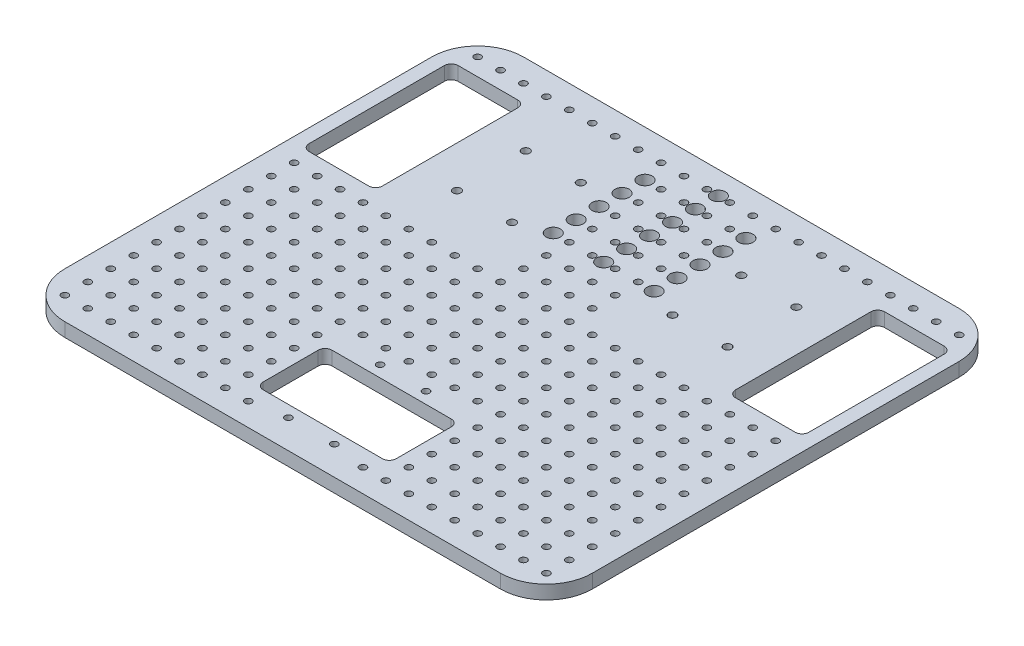
from build123d import *

# Parameters (mm, degrees)
SKETCH_1_W          = 230
SKETCH_1_H          = 200
SKETCH_1_R          = 1.73
EXTRUDE_1_DEPTH     = 6
FILLET_1_R          = 20
SKETCH_2_R          = 1.5
SKETCH_2_W          = 32
SKETCH_2_H          = 65
SKETCH_2_W_2        = 58
SKETCH_2_H_2        = 30
CUT_EXTRUDE_1_DEPTH = 10
FILLET_2_R          = 3
SKETCH_3_R          = 1.5
SKETCH_3_R_2        = 3.1
CUT_EXTRUDE_2_DEPTH = 10


with BuildPart() as part:
    # Эскиз1 → Бобышка-Вытянуть1 (new body)
    with BuildSketch(Plane(origin=(0, 0, 0), x_dir=(1, 0, 0), z_dir=(0, 1, 0))):
        with Locations((115, 100)):
            Rectangle(SKETCH_1_W, SKETCH_1_H)
        with Locations((80, 135)):
            Circle(SKETCH_1_R, mode=Mode.SUBTRACT)
        with Locations((80, 165)):
            Circle(SKETCH_1_R, mode=Mode.SUBTRACT)
        with Locations((56, 165)):
            Circle(SKETCH_1_R, mode=Mode.SUBTRACT)
        with Locations((56, 135)):
            Circle(SKETCH_1_R, mode=Mode.SUBTRACT)
        with Locations((150, 135)):
            Circle(SKETCH_1_R, mode=Mode.SUBTRACT)
        with Locations((174, 135)):
            Circle(SKETCH_1_R, mode=Mode.SUBTRACT)
        with Locations((150, 165)):
            Circle(SKETCH_1_R, mode=Mode.SUBTRACT)
        with Locations((174, 165)):
            Circle(SKETCH_1_R, mode=Mode.SUBTRACT)
    extrude(amount=EXTRUDE_1_DEPTH)

    # Скругление1
    fillet_1_edges = [part.edges().sort_by_distance(p)[0] for p in [
        (0, 3, 0),
        (230, 3, 0),
        (230, 3, -200),
        (0, 3, -200),
    ]]
    fillet(fillet_1_edges, radius=FILLET_1_R)

    # Эскиз2 → Вырез-Вытянуть1 (cut)
    with BuildSketch(Plane(origin=(0, 6, 0), x_dir=(1, 0, 0), z_dir=(0, 1, 0))):
        with Locations((105, 12.5)):
            Circle(SKETCH_2_R)
        with Locations((125, 12.5)):
            Circle(SKETCH_2_R)
        with Locations((105, 52.5)):
            Circle(SKETCH_2_R)
        with Locations((125, 52.5)):
            Circle(SKETCH_2_R)
        with Locations((208, 150)):
            Rectangle(SKETCH_2_W, SKETCH_2_H)
        with Locations((22, 150)):
            Rectangle(SKETCH_2_W, SKETCH_2_H)
        with Locations((115, 32.5)):
            Rectangle(SKETCH_2_W_2, SKETCH_2_H_2)
    extrude(amount=-CUT_EXTRUDE_1_DEPTH, mode=Mode.SUBTRACT)

    # Скругление2
    fillet_2_edges = [part.edges().sort_by_distance(p)[0] for p in [
        (224, 3, -117.5),
        (224, 3, -182.5),
        (192, 3, -182.5),
        (192, 3, -117.5),
        (6, 3, -117.5),
        (38, 3, -117.5),
        (38, 3, -182.5),
        (6, 3, -182.5),
        (86, 3, -17.5),
        (144, 3, -17.5),
        (144, 3, -47.5),
        (86, 3, -47.5),
    ]]
    fillet(fillet_2_edges, radius=FILLET_2_R)

    # Эскиз3 → Вырез-Вытянуть2 (cut)
    with BuildSketch(Plane(origin=(0, 6, 0), x_dir=(1, 0, 0), z_dir=(0, 1, 0))):
        with Locations((10, 10)):
            Circle(SKETCH_3_R)
        with Locations((20, 10)):
            Circle(SKETCH_3_R)
        with Locations((30, 10)):
            Circle(SKETCH_3_R)
        with Locations((40, 10)):
            Circle(SKETCH_3_R)
        with Locations((50, 10)):
            Circle(SKETCH_3_R)
        with Locations((60, 10)):
            Circle(SKETCH_3_R)
        with Locations((70, 10)):
            Circle(SKETCH_3_R)
        with Locations((80, 10)):
            Circle(SKETCH_3_R)
        with Locations((90, 10)):
            Circle(SKETCH_3_R)
        with Locations((140, 10)):
            Circle(SKETCH_3_R)
        with Locations((150, 10)):
            Circle(SKETCH_3_R)
        with Locations((160, 10)):
            Circle(SKETCH_3_R)
        with Locations((170, 10)):
            Circle(SKETCH_3_R)
        with Locations((180, 10)):
            Circle(SKETCH_3_R)
        with Locations((190, 10)):
            Circle(SKETCH_3_R)
        with Locations((200, 10)):
            Circle(SKETCH_3_R)
        with Locations((210, 10)):
            Circle(SKETCH_3_R)
        with Locations((220, 10)):
            Circle(SKETCH_3_R)
        with Locations((20, 20)):
            Circle(SKETCH_3_R)
        with Locations((30, 20)):
            Circle(SKETCH_3_R)
        with Locations((40, 20)):
            Circle(SKETCH_3_R)
        with Locations((50, 20)):
            Circle(SKETCH_3_R)
        with Locations((60, 20)):
            Circle(SKETCH_3_R)
        with Locations((70, 20)):
            Circle(SKETCH_3_R)
        with Locations((80, 20)):
            Circle(SKETCH_3_R)
        with Locations((150, 20)):
            Circle(SKETCH_3_R)
        with Locations((160, 20)):
            Circle(SKETCH_3_R)
        with Locations((170, 20)):
            Circle(SKETCH_3_R)
        with Locations((180, 20)):
            Circle(SKETCH_3_R)
        with Locations((190, 20)):
            Circle(SKETCH_3_R)
        with Locations((200, 20)):
            Circle(SKETCH_3_R)
        with Locations((210, 20)):
            Circle(SKETCH_3_R)
        with Locations((220, 20)):
            Circle(SKETCH_3_R)
        with Locations((20, 30)):
            Circle(SKETCH_3_R)
        with Locations((30, 30)):
            Circle(SKETCH_3_R)
        with Locations((40, 30)):
            Circle(SKETCH_3_R)
        with Locations((50, 30)):
            Circle(SKETCH_3_R)
        with Locations((60, 30)):
            Circle(SKETCH_3_R)
        with Locations((70, 30)):
            Circle(SKETCH_3_R)
        with Locations((80, 30)):
            Circle(SKETCH_3_R)
        with Locations((150, 30)):
            Circle(SKETCH_3_R)
        with Locations((160, 30)):
            Circle(SKETCH_3_R)
        with Locations((170, 30)):
            Circle(SKETCH_3_R)
        with Locations((180, 30)):
            Circle(SKETCH_3_R)
        with Locations((190, 30)):
            Circle(SKETCH_3_R)
        with Locations((200, 30)):
            Circle(SKETCH_3_R)
        with Locations((210, 30)):
            Circle(SKETCH_3_R)
        with Locations((220, 30)):
            Circle(SKETCH_3_R)
        with Locations((20, 40)):
            Circle(SKETCH_3_R)
        with Locations((30, 40)):
            Circle(SKETCH_3_R)
        with Locations((40, 40)):
            Circle(SKETCH_3_R)
        with Locations((50, 40)):
            Circle(SKETCH_3_R)
        with Locations((60, 40)):
            Circle(SKETCH_3_R)
        with Locations((70, 40)):
            Circle(SKETCH_3_R)
        with Locations((80, 40)):
            Circle(SKETCH_3_R)
        with Locations((150, 40)):
            Circle(SKETCH_3_R)
        with Locations((160, 40)):
            Circle(SKETCH_3_R)
        with Locations((170, 40)):
            Circle(SKETCH_3_R)
        with Locations((180, 40)):
            Circle(SKETCH_3_R)
        with Locations((190, 40)):
            Circle(SKETCH_3_R)
        with Locations((200, 40)):
            Circle(SKETCH_3_R)
        with Locations((210, 40)):
            Circle(SKETCH_3_R)
        with Locations((220, 40)):
            Circle(SKETCH_3_R)
        with Locations((20, 50)):
            Circle(SKETCH_3_R)
        with Locations((30, 50)):
            Circle(SKETCH_3_R)
        with Locations((40, 50)):
            Circle(SKETCH_3_R)
        with Locations((50, 50)):
            Circle(SKETCH_3_R)
        with Locations((60, 50)):
            Circle(SKETCH_3_R)
        with Locations((70, 50)):
            Circle(SKETCH_3_R)
        with Locations((80, 50)):
            Circle(SKETCH_3_R)
        with Locations((150, 50)):
            Circle(SKETCH_3_R)
        with Locations((160, 50)):
            Circle(SKETCH_3_R)
        with Locations((170, 50)):
            Circle(SKETCH_3_R)
        with Locations((180, 50)):
            Circle(SKETCH_3_R)
        with Locations((190, 50)):
            Circle(SKETCH_3_R)
        with Locations((200, 50)):
            Circle(SKETCH_3_R)
        with Locations((210, 50)):
            Circle(SKETCH_3_R)
        with Locations((220, 50)):
            Circle(SKETCH_3_R)
        with Locations((20, 60)):
            Circle(SKETCH_3_R)
        with Locations((30, 60)):
            Circle(SKETCH_3_R)
        with Locations((40, 60)):
            Circle(SKETCH_3_R)
        with Locations((50, 60)):
            Circle(SKETCH_3_R)
        with Locations((60, 60)):
            Circle(SKETCH_3_R)
        with Locations((70, 60)):
            Circle(SKETCH_3_R)
        with Locations((80, 60)):
            Circle(SKETCH_3_R)
        with Locations((90, 60)):
            Circle(SKETCH_3_R)
        with Locations((100, 60)):
            Circle(SKETCH_3_R)
        with Locations((110, 60)):
            Circle(SKETCH_3_R)
        with Locations((120, 60)):
            Circle(SKETCH_3_R)
        with Locations((130, 60)):
            Circle(SKETCH_3_R)
        with Locations((140, 60)):
            Circle(SKETCH_3_R)
        with Locations((150, 60)):
            Circle(SKETCH_3_R)
        with Locations((160, 60)):
            Circle(SKETCH_3_R)
        with Locations((170, 60)):
            Circle(SKETCH_3_R)
        with Locations((180, 60)):
            Circle(SKETCH_3_R)
        with Locations((190, 60)):
            Circle(SKETCH_3_R)
        with Locations((200, 60)):
            Circle(SKETCH_3_R)
        with Locations((210, 60)):
            Circle(SKETCH_3_R)
        with Locations((220, 60)):
            Circle(SKETCH_3_R)
        with Locations((20, 70)):
            Circle(SKETCH_3_R)
        with Locations((30, 70)):
            Circle(SKETCH_3_R)
        with Locations((40, 70)):
            Circle(SKETCH_3_R)
        with Locations((50, 70)):
            Circle(SKETCH_3_R)
        with Locations((60, 70)):
            Circle(SKETCH_3_R)
        with Locations((70, 70)):
            Circle(SKETCH_3_R)
        with Locations((80, 70)):
            Circle(SKETCH_3_R)
        with Locations((90, 70)):
            Circle(SKETCH_3_R)
        with Locations((100, 70)):
            Circle(SKETCH_3_R)
        with Locations((110, 70)):
            Circle(SKETCH_3_R)
        with Locations((120, 70)):
            Circle(SKETCH_3_R)
        with Locations((130, 70)):
            Circle(SKETCH_3_R)
        with Locations((140, 70)):
            Circle(SKETCH_3_R)
        with Locations((150, 70)):
            Circle(SKETCH_3_R)
        with Locations((160, 70)):
            Circle(SKETCH_3_R)
        with Locations((170, 70)):
            Circle(SKETCH_3_R)
        with Locations((180, 70)):
            Circle(SKETCH_3_R)
        with Locations((190, 70)):
            Circle(SKETCH_3_R)
        with Locations((200, 70)):
            Circle(SKETCH_3_R)
        with Locations((210, 70)):
            Circle(SKETCH_3_R)
        with Locations((220, 70)):
            Circle(SKETCH_3_R)
        with Locations((20, 80)):
            Circle(SKETCH_3_R)
        with Locations((30, 80)):
            Circle(SKETCH_3_R)
        with Locations((40, 80)):
            Circle(SKETCH_3_R)
        with Locations((50, 80)):
            Circle(SKETCH_3_R)
        with Locations((60, 80)):
            Circle(SKETCH_3_R)
        with Locations((70, 80)):
            Circle(SKETCH_3_R)
        with Locations((80, 80)):
            Circle(SKETCH_3_R)
        with Locations((90, 80)):
            Circle(SKETCH_3_R)
        with Locations((100, 80)):
            Circle(SKETCH_3_R)
        with Locations((110, 80)):
            Circle(SKETCH_3_R)
        with Locations((120, 80)):
            Circle(SKETCH_3_R)
        with Locations((130, 80)):
            Circle(SKETCH_3_R)
        with Locations((140, 80)):
            Circle(SKETCH_3_R)
        with Locations((150, 80)):
            Circle(SKETCH_3_R)
        with Locations((160, 80)):
            Circle(SKETCH_3_R)
        with Locations((170, 80)):
            Circle(SKETCH_3_R)
        with Locations((180, 80)):
            Circle(SKETCH_3_R)
        with Locations((190, 80)):
            Circle(SKETCH_3_R)
        with Locations((200, 80)):
            Circle(SKETCH_3_R)
        with Locations((210, 80)):
            Circle(SKETCH_3_R)
        with Locations((220, 80)):
            Circle(SKETCH_3_R)
        with Locations((20, 90)):
            Circle(SKETCH_3_R)
        with Locations((30, 90)):
            Circle(SKETCH_3_R)
        with Locations((40, 90)):
            Circle(SKETCH_3_R)
        with Locations((50, 90)):
            Circle(SKETCH_3_R)
        with Locations((60, 90)):
            Circle(SKETCH_3_R)
        with Locations((70, 90)):
            Circle(SKETCH_3_R)
        with Locations((80, 90)):
            Circle(SKETCH_3_R)
        with Locations((90, 90)):
            Circle(SKETCH_3_R)
        with Locations((100, 90)):
            Circle(SKETCH_3_R)
        with Locations((110, 90)):
            Circle(SKETCH_3_R)
        with Locations((120, 90)):
            Circle(SKETCH_3_R)
        with Locations((130, 90)):
            Circle(SKETCH_3_R)
        with Locations((140, 90)):
            Circle(SKETCH_3_R)
        with Locations((150, 90)):
            Circle(SKETCH_3_R)
        with Locations((160, 90)):
            Circle(SKETCH_3_R)
        with Locations((170, 90)):
            Circle(SKETCH_3_R)
        with Locations((180, 90)):
            Circle(SKETCH_3_R)
        with Locations((190, 90)):
            Circle(SKETCH_3_R)
        with Locations((200, 90)):
            Circle(SKETCH_3_R)
        with Locations((210, 90)):
            Circle(SKETCH_3_R)
        with Locations((220, 90)):
            Circle(SKETCH_3_R)
        with Locations((20, 100)):
            Circle(SKETCH_3_R)
        with Locations((30, 100)):
            Circle(SKETCH_3_R)
        with Locations((40, 100)):
            Circle(SKETCH_3_R)
        with Locations((50, 100)):
            Circle(SKETCH_3_R)
        with Locations((60, 100)):
            Circle(SKETCH_3_R)
        with Locations((70, 100)):
            Circle(SKETCH_3_R)
        with Locations((80, 100)):
            Circle(SKETCH_3_R)
        with Locations((90, 100)):
            Circle(SKETCH_3_R)
        with Locations((100, 100)):
            Circle(SKETCH_3_R)
        with Locations((110, 100)):
            Circle(SKETCH_3_R)
        with Locations((120, 100)):
            Circle(SKETCH_3_R)
        with Locations((130, 100)):
            Circle(SKETCH_3_R)
        with Locations((140, 100)):
            Circle(SKETCH_3_R)
        with Locations((150, 100)):
            Circle(SKETCH_3_R)
        with Locations((160, 100)):
            Circle(SKETCH_3_R)
        with Locations((170, 100)):
            Circle(SKETCH_3_R)
        with Locations((180, 100)):
            Circle(SKETCH_3_R)
        with Locations((190, 100)):
            Circle(SKETCH_3_R)
        with Locations((200, 100)):
            Circle(SKETCH_3_R)
        with Locations((210, 100)):
            Circle(SKETCH_3_R)
        with Locations((220, 100)):
            Circle(SKETCH_3_R)
        with Locations((20, 110)):
            Circle(SKETCH_3_R)
        with Locations((30, 110)):
            Circle(SKETCH_3_R)
        with Locations((40, 110)):
            Circle(SKETCH_3_R)
        with Locations((50, 110)):
            Circle(SKETCH_3_R)
        with Locations((60, 110)):
            Circle(SKETCH_3_R)
        with Locations((70, 110)):
            Circle(SKETCH_3_R)
        with Locations((80, 110)):
            Circle(SKETCH_3_R)
        with Locations((90, 110)):
            Circle(SKETCH_3_R)
        with Locations((100, 110)):
            Circle(SKETCH_3_R)
        with Locations((110, 110)):
            Circle(SKETCH_3_R)
        with Locations((120, 110)):
            Circle(SKETCH_3_R)
        with Locations((130, 110)):
            Circle(SKETCH_3_R)
        with Locations((140, 110)):
            Circle(SKETCH_3_R)
        with Locations((150, 110)):
            Circle(SKETCH_3_R)
        with Locations((160, 110)):
            Circle(SKETCH_3_R)
        with Locations((170, 110)):
            Circle(SKETCH_3_R)
        with Locations((180, 110)):
            Circle(SKETCH_3_R)
        with Locations((190, 110)):
            Circle(SKETCH_3_R)
        with Locations((200, 110)):
            Circle(SKETCH_3_R)
        with Locations((210, 110)):
            Circle(SKETCH_3_R)
        with Locations((220, 110)):
            Circle(SKETCH_3_R)
        with Locations((100, 120)):
            Circle(SKETCH_3_R)
        with Locations((110, 120)):
            Circle(SKETCH_3_R)
        with Locations((120, 120)):
            Circle(SKETCH_3_R)
        with Locations((130, 120)):
            Circle(SKETCH_3_R)
        with Locations((100, 130)):
            Circle(SKETCH_3_R)
        with Locations((110, 130)):
            Circle(SKETCH_3_R)
        with Locations((120, 130)):
            Circle(SKETCH_3_R)
        with Locations((130, 130)):
            Circle(SKETCH_3_R)
        with Locations((100, 140)):
            Circle(SKETCH_3_R)
        with Locations((110, 140)):
            Circle(SKETCH_3_R)
        with Locations((120, 140)):
            Circle(SKETCH_3_R)
        with Locations((130, 140)):
            Circle(SKETCH_3_R)
        with Locations((100, 150)):
            Circle(SKETCH_3_R)
        with Locations((110, 150)):
            Circle(SKETCH_3_R)
        with Locations((120, 150)):
            Circle(SKETCH_3_R)
        with Locations((130, 150)):
            Circle(SKETCH_3_R)
        with Locations((100, 160)):
            Circle(SKETCH_3_R)
        with Locations((110, 160)):
            Circle(SKETCH_3_R)
        with Locations((120, 160)):
            Circle(SKETCH_3_R)
        with Locations((130, 160)):
            Circle(SKETCH_3_R)
        with Locations((100, 170)):
            Circle(SKETCH_3_R)
        with Locations((110, 170)):
            Circle(SKETCH_3_R)
        with Locations((120, 170)):
            Circle(SKETCH_3_R)
        with Locations((130, 170)):
            Circle(SKETCH_3_R)
        with Locations((100, 180)):
            Circle(SKETCH_3_R)
        with Locations((110, 180)):
            Circle(SKETCH_3_R)
        with Locations((120, 180)):
            Circle(SKETCH_3_R)
        with Locations((130, 180)):
            Circle(SKETCH_3_R)
        with Locations((20, 190)):
            Circle(SKETCH_3_R)
        with Locations((30, 190)):
            Circle(SKETCH_3_R)
        with Locations((40, 190)):
            Circle(SKETCH_3_R)
        with Locations((50, 190)):
            Circle(SKETCH_3_R)
        with Locations((60, 190)):
            Circle(SKETCH_3_R)
        with Locations((70, 190)):
            Circle(SKETCH_3_R)
        with Locations((80, 190)):
            Circle(SKETCH_3_R)
        with Locations((90, 190)):
            Circle(SKETCH_3_R)
        with Locations((100, 190)):
            Circle(SKETCH_3_R)
        with Locations((110, 190)):
            Circle(SKETCH_3_R)
        with Locations((120, 190)):
            Circle(SKETCH_3_R)
        with Locations((130, 190)):
            Circle(SKETCH_3_R)
        with Locations((140, 190)):
            Circle(SKETCH_3_R)
        with Locations((150, 190)):
            Circle(SKETCH_3_R)
        with Locations((160, 190)):
            Circle(SKETCH_3_R)
        with Locations((170, 190)):
            Circle(SKETCH_3_R)
        with Locations((180, 190)):
            Circle(SKETCH_3_R)
        with Locations((190, 190)):
            Circle(SKETCH_3_R)
        with Locations((200, 190)):
            Circle(SKETCH_3_R)
        with Locations((210, 190)):
            Circle(SKETCH_3_R)
        with Locations((220, 190)):
            Circle(SKETCH_3_R)
        with Locations((10, 20)):
            Circle(SKETCH_3_R)
        with Locations((10, 30)):
            Circle(SKETCH_3_R)
        with Locations((10, 40)):
            Circle(SKETCH_3_R)
        with Locations((10, 50)):
            Circle(SKETCH_3_R)
        with Locations((10, 60)):
            Circle(SKETCH_3_R)
        with Locations((10, 70)):
            Circle(SKETCH_3_R)
        with Locations((10, 80)):
            Circle(SKETCH_3_R)
        with Locations((10, 90)):
            Circle(SKETCH_3_R)
        with Locations((10, 100)):
            Circle(SKETCH_3_R)
        with Locations((10, 110)):
            Circle(SKETCH_3_R)
        with Locations((10, 190)):
            Circle(SKETCH_3_R)
        with Locations((115, 190)):
            Circle(SKETCH_3_R_2)
        with Locations((115, 180)):
            Circle(SKETCH_3_R_2)
        with Locations((115, 170)):
            Circle(SKETCH_3_R_2)
        with Locations((115, 160)):
            Circle(SKETCH_3_R_2)
        with Locations((115, 150)):
            Circle(SKETCH_3_R_2)
        with Locations((115, 140)):
            Circle(SKETCH_3_R_2)
        with Locations((137, 180)):
            Circle(SKETCH_3_R_2)
        with Locations((93, 180)):
            Circle(SKETCH_3_R_2)
        with Locations((93, 170)):
            Circle(SKETCH_3_R_2)
        with Locations((137, 170)):
            Circle(SKETCH_3_R_2)
        with Locations((93, 160)):
            Circle(SKETCH_3_R_2)
        with Locations((137, 160)):
            Circle(SKETCH_3_R_2)
        with Locations((93, 150)):
            Circle(SKETCH_3_R_2)
        with Locations((137, 150)):
            Circle(SKETCH_3_R_2)
        with Locations((93, 140)):
            Circle(SKETCH_3_R_2)
        with Locations((137, 140)):
            Circle(SKETCH_3_R_2)
    extrude(amount=-CUT_EXTRUDE_2_DEPTH, mode=Mode.SUBTRACT)


solid = part.part
